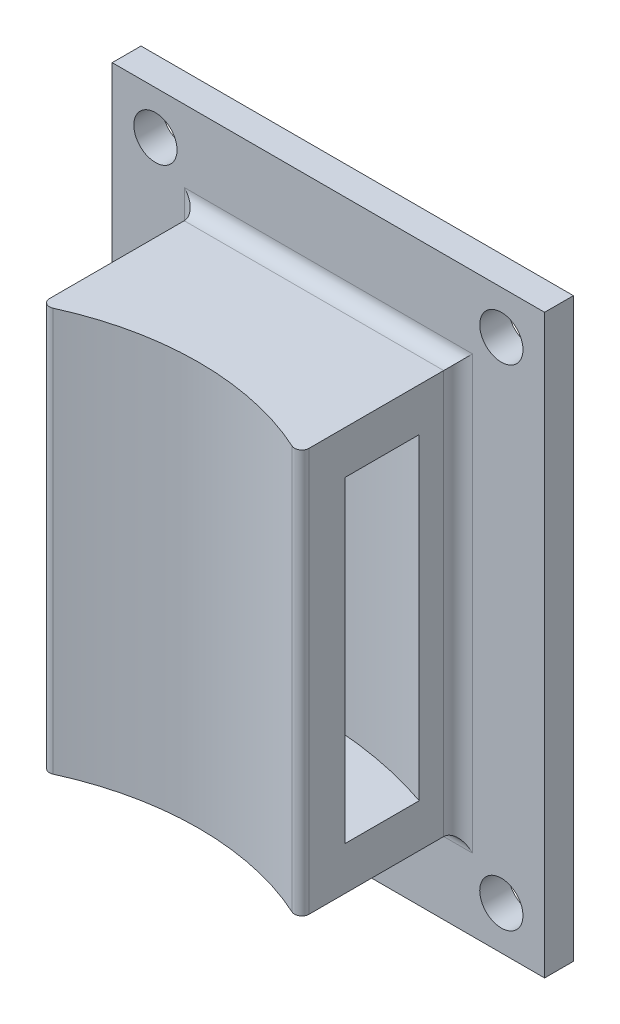
from build123d import *

# Parameters (mm, degrees)
EXTRUDE_1_DEPTH     = 11
EXTRUDE_1_2_DEPTH   = 11
EXTRUDE_2_DEPTH     = 3
SKETCH_5_W          = 30
SKETCH_5_H          = 40
SKETCH_5_W_2        = 18
SKETCH_5_H_2        = 28
EXTRUDE_3_DEPTH     = 2
SKETCH_6_R          = 1.5
CUT_EXTRUDE_1_DEPTH = 28.369451515
FILLET_1_R          = 1
FILLET_2_R          = 0.5


with BuildPart() as part:
    # 草图1 → 凸台-拉伸1 (new, symmetric)
    with BuildSketch(Plane(origin=(0, 0, 0), x_dir=(1, 0, 0), z_dir=(0, 1, 0))):
        with BuildLine():
            Line((-9, 31), (-9, 26.302851556))
            ThreePointArc((-9, 26.302851556), (0, 27.8), (9, 26.302851556))
            Line((9, 26.302851556), (9, 31))
            Line((9, 31), (-9, 31))
        make_face()
    extrude(amount=EXTRUDE_1_DEPTH, both=True)



with BuildPart() as body_2:
    # 草图1 → Extrude 1 2 (new, symmetric)
    with BuildSketch(Plane(origin=(0, 0, 0), x_dir=(1, 0, 0), z_dir=(0, 1, 0))):
        with BuildLine():
            Line((-9, 21.166010489), (-9, 17.860571099))
            ThreePointArc((-9, 17.860571099), (0, 20), (9, 17.860571099))
            Line((9, 17.860571099), (9, 21.166010489))
            ThreePointArc((9, 21.166010489), (0, 23), (-9, 21.166010489))
        make_face()
    extrude(amount=EXTRUDE_1_2_DEPTH, both=True)


with BuildPart() as part_1:
    add(part.part)

    add(body_2.part)  # 凸台-拉伸2 merges body 2
    # 草图2 → 凸台-拉伸2 (add)
    with BuildSketch(Plane(origin=(0, 11, 0), x_dir=(1, 0, 0), z_dir=(0, 1, 0))):
        with BuildLine():
            Line((-9, 31), (-9, 17.860571099))
            ThreePointArc((-9, 17.860571099), (0, 20), (9, 17.860571099))
            Line((9, 17.860571099), (9, 31))
            Line((9, 31), (-9, 31))
        make_face()
    extrude_2 = extrude(amount=EXTRUDE_2_DEPTH)

    # 镜向1: 凸台-拉伸2 across plane
    add(extrude_2.mirror(Plane.ZX))

    # 草图5 → 凸台-拉伸3 (add)
    with BuildSketch(Plane(origin=(0, 0, -31), x_dir=(-1, 0, 0), z_dir=(0, 0, -1))):
        Rectangle(SKETCH_5_W, SKETCH_5_H)
        Rectangle(SKETCH_5_W_2, SKETCH_5_H_2, mode=Mode.SUBTRACT)
    extrude(amount=-EXTRUDE_3_DEPTH)

    # 草图6 → 切除-拉伸1 (cut, through all)
    with BuildSketch(Plane.XY.offset(-29)):
        with Locations((12, 17)):
            Circle(SKETCH_6_R)
        with Locations((-12, 17)):
            Circle(SKETCH_6_R)
        with Locations((12, -17)):
            Circle(SKETCH_6_R)
        with Locations((-12, -17)):
            Circle(SKETCH_6_R)
    extrude(amount=-CUT_EXTRUDE_1_DEPTH, mode=Mode.SUBTRACT)

    # 圆角1
    fillet_1_edges = [part_1.edges().sort_by_distance(p)[0] for p in [
        (9, 0, -29),
        (0, 14, -29),
        (-9, 0, -29),
        (0, -14, -29),
    ]]
    fillet(fillet_1_edges, radius=FILLET_1_R)

    # 圆角2
    fillet_2_edges = [part_1.edges().sort_by_distance(p)[0] for p in [
        (9, 0, -17.860571099),
        (-9, 0, -17.860571099),
    ]]
    fillet(fillet_2_edges, radius=FILLET_2_R)


solid = part_1.part
